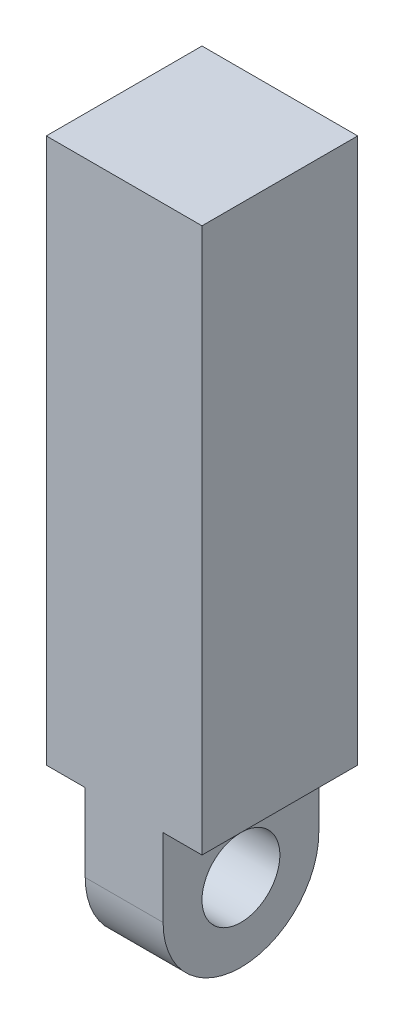
from build123d import *

# Parameters (mm, degrees)
SKETCH1_W           = 101.6
SKETCH1_H           = 101.6
BOSS_EXTRUDE1_DEPTH = 457.2
SKETCH2_W           = 25.4
SKETCH2_H           = 101.6
CUT_EXTRUDE1_DEPTH  = 472.099819571
FILLET1_R           = 50.8
SKETCH3_R           = 25.4
CUT_EXTRUDE2_DEPTH  = 467.282017667


with BuildPart() as part:
    # Sketch1 → Boss-Extrude1 (new body)
    with BuildSketch(Plane(origin=(0, 0, 0), x_dir=(1, 0, 0), z_dir=(0, 1, 0))):
        Rectangle(SKETCH1_W, SKETCH1_H)
    extrude(amount=BOSS_EXTRUDE1_DEPTH)

    # Sketch2 → Cut-Extrude1 (cut, through all)
    with BuildSketch(Plane.XY.offset(50.8)):
        with Locations((-38.1, 50.8)):
            Rectangle(SKETCH2_W, SKETCH2_H)
        with Locations((38.1, 50.8)):
            Rectangle(SKETCH2_W, SKETCH2_H)
    extrude(amount=-CUT_EXTRUDE1_DEPTH, mode=Mode.SUBTRACT)

    # Fillet1
    fillet1_edges = [part.edges().sort_by_distance(p)[0] for p in [
        (0, 0, -50.8),
        (0, 0, 50.8),
    ]]
    fillet(fillet1_edges, radius=FILLET1_R - 0.0001)  # a hair under: the kernel refuses the full size

    # Sketch3 → Cut-Extrude2 (cut, through all)
    with BuildSketch(Plane.ZY.offset(25.4)):
        with Locations((0, 50.8)):
            Circle(SKETCH3_R)
    extrude(amount=-CUT_EXTRUDE2_DEPTH, mode=Mode.SUBTRACT)


solid = part.part
